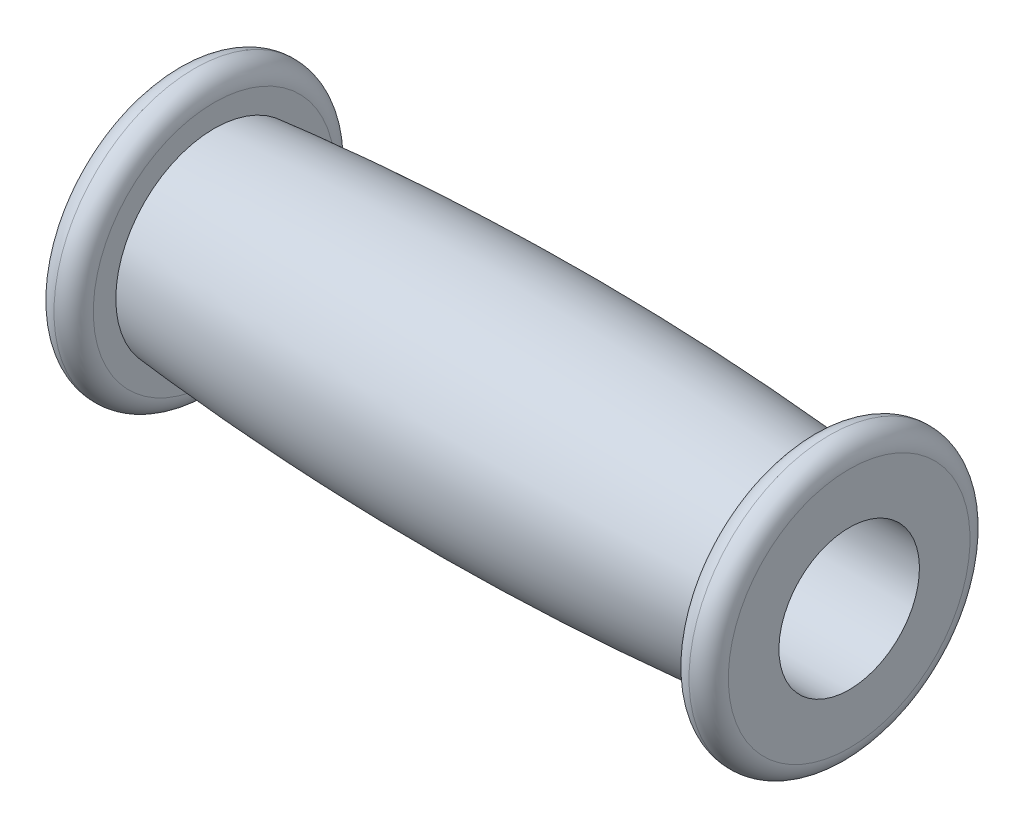
from build123d import *

# Parameters (mm, degrees)
SKETCH2_R          = 12.5
CUT_EXTRUDE1_DEPTH = 126.099960032
FILLET2_R          = 3.5


with BuildPart() as part:
    # Sketch1 → Revolve1 (revolve)
    with BuildSketch(Plane.XY):
        with BuildLine():
            Line((0, 0), (0, 25))
            Line((0, 25), (7, 25))
            Line((7, 25), (7, 17.5))
            add(Edge.make_bspline(
                [(7, 17.5), (59.999495383, 22.500022889), (113, 17.5)],
                knots=[0, 0, 0, 1, 1, 1], degree=2))
            Line((113, 17.5), (113, 25))
            Line((113, 25), (120, 25))
            Line((120, 25), (120, 0))
            Line((120, 0), (0, 0))
        make_face()
    revolve(axis=Axis((120, 0, 0), (-1, 0, 0)))

    # Sketch2 → Cut-Extrude1 (cut, through all)
    with BuildSketch(Plane.ZY):
        with Locations(Location((0, 0, 0), (0, 0, 270))):
            Circle(SKETCH2_R)
    extrude(amount=-CUT_EXTRUDE1_DEPTH, mode=Mode.SUBTRACT)

    # Fillet2
    fillet2_edges = [part.edges().sort_by_distance(p)[0] for p in [
        (0, -25, 0),
        (7, -25, 0),
        (113, -25, 0),
        (120, -25, 0),
    ]]
    fillet(fillet2_edges, radius=FILLET2_R - 0.0001)  # a hair under: the kernel refuses the full size


solid = part.part
